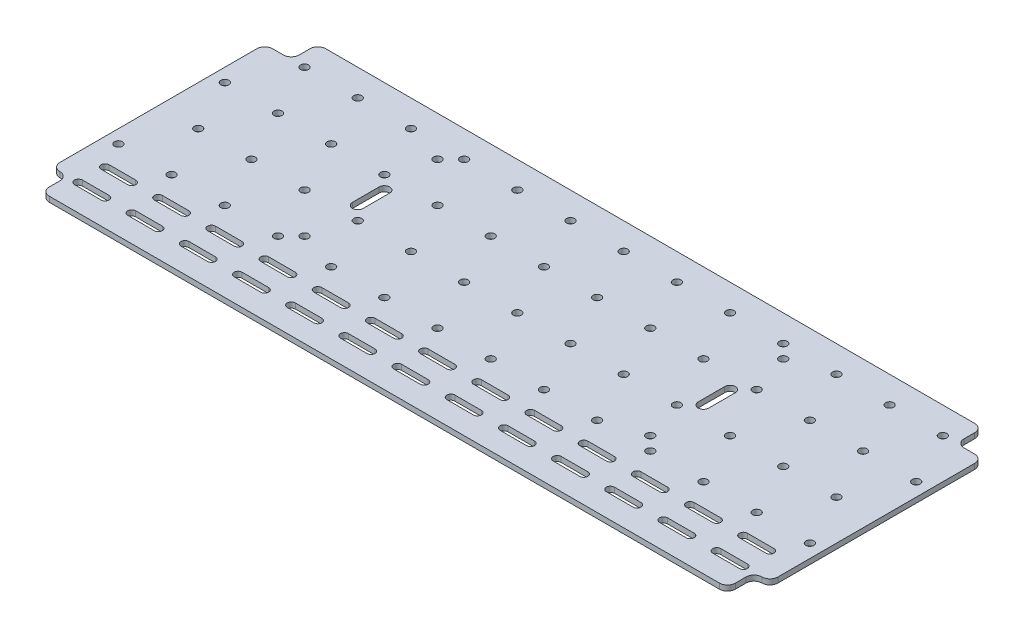
from build123d import *

# Parameters (mm, degrees)
SKETCH_1_W          = 270
SKETCH_1_H          = 100
EXTRUDE_1_DEPTH     = 2
SKETCH_2_W          = 6
SKETCH_2_H          = 10
SKETCH_2_W_2        = 10
CUT_EXTRUDE_1_DEPTH = 10
FILLET_1_R          = 3
SKETCH_3_R          = 1.5
CUT_EXTRUDE_2_DEPTH = 30
SKETCH_4_R          = 1.5
CUT_EXTRUDE_3_DEPTH = 10


with BuildPart() as part:
    # 草图1 → 凸台-拉伸1 (new body)
    with BuildSketch(Plane(origin=(0, 0, 0), x_dir=(1, 0, 0), z_dir=(0, 1, 0))):
        Rectangle(SKETCH_1_W, SKETCH_1_H)
    extrude(amount=EXTRUDE_1_DEPTH)

    # 草图2 → 切除-拉伸1 (cut)
    with BuildSketch(Plane.XZ):
        with Locations((132, 45)):
            Rectangle(SKETCH_2_W, SKETCH_2_H)
        with Locations((130, -45)):
            Rectangle(SKETCH_2_W_2, SKETCH_2_H)
        with Locations((-130, -45)):
            Rectangle(SKETCH_2_W_2, SKETCH_2_H)
        with Locations((-132, 45)):
            Rectangle(SKETCH_2_W, SKETCH_2_H)
    extrude(amount=-CUT_EXTRUDE_1_DEPTH, mode=Mode.SUBTRACT)

    # 圆角1
    fillet_1_edges = [part.edges().sort_by_distance(p)[0] for p in [
        (-125, 1, -40),
        (-125, 1, -50),
        (125, 1, -50),
        (125, 1, -40),
        (135, 1, -40),
        (-135, 1, -40),
        (129, 1, 40),
        (129, 1, 50),
        (-129, 1, 50),
        (-129, 1, 40),
        (135, 1, 40),
        (-135, 1, 40),
    ]]
    fillet(fillet_1_edges, radius=FILLET_1_R - 0.0001)  # a hair under: the kernel refuses the full size

    # 草图3 → 切除-拉伸2 (cut)
    with BuildSketch(Plane.XZ):
        with Locations(Location((-65, 15, 0), (0, 0, 270))):
            Circle(SKETCH_3_R)
        with Locations(Location((-65, -35, 0), (0, 0, 270))):
            Circle(SKETCH_3_R)
        with Locations(Location((65, -35, 0), (0, 0, 270))):
            Circle(SKETCH_3_R)
        with Locations(Location((65, 15, 0), (0, 0, 270))):
            Circle(SKETCH_3_R)
        with BuildLine():
            Line((-63, -5), (-63, -15))
            ThreePointArc((-63, -15), (-65, -17), (-67, -15))
            Line((-67, -15), (-67, -5))
            ThreePointArc((-67, -5), (-65, -3), (-63, -5))
        make_face()
        with BuildLine():
            Line((63, -5), (63, -15))
            ThreePointArc((63, -15), (65, -17), (67, -15))
            Line((67, -15), (67, -5))
            ThreePointArc((67, -5), (65, -3), (63, -5))
        make_face()
    extrude(amount=-CUT_EXTRUDE_2_DEPTH, mode=Mode.SUBTRACT)

    # 草图4 → 切除-拉伸3 (cut)
    with BuildSketch(Plane.XZ):
        with Locations(Location((-130, 20, 0), (0, 0, 270))):
            Circle(SKETCH_4_R)
        with Locations(Location((-110, 20, 0), (0, 0, 270))):
            Circle(SKETCH_4_R)
        with Locations(Location((-120, 0, 0), (0, 0, 270))):
            Circle(SKETCH_4_R)
        with Locations(Location((-130, -20, 0), (0, 0, 270))):
            Circle(SKETCH_4_R)
        with Locations(Location((-110, -20, 0), (0, 0, 270))):
            Circle(SKETCH_4_R)
        with Locations(Location((-120, -40, 0), (0, 0, 270))):
            Circle(SKETCH_4_R)
        with Locations(Location((-100, -40, 0), (0, 0, 270))):
            Circle(SKETCH_4_R)
        with Locations(Location((-90, 20, 0), (0, 0, 270))):
            Circle(SKETCH_4_R)
        with Locations(Location((-70, 20, 0), (0, 0, 270))):
            Circle(SKETCH_4_R)
        with Locations(Location((-80, 0, 0), (0, 0, 270))):
            Circle(SKETCH_4_R)
        with Locations(Location((-90, -20, 0), (0, 0, 270))):
            Circle(SKETCH_4_R)
        with Locations(Location((-70, -20, 0), (0, 0, 270))):
            Circle(SKETCH_4_R)
        with Locations(Location((-80, -40, 0), (0, 0, 270))):
            Circle(SKETCH_4_R)
        with Locations(Location((-60, -40, 0), (0, 0, 270))):
            Circle(SKETCH_4_R)
        with Locations(Location((-50, 20, 0), (0, 0, 270))):
            Circle(SKETCH_4_R)
        with Locations(Location((-30, 20, 0), (0, 0, 270))):
            Circle(SKETCH_4_R)
        with Locations(Location((-40, 0, 0), (0, 0, 270))):
            Circle(SKETCH_4_R)
        with Locations(Location((-50, -20, 0), (0, 0, 270))):
            Circle(SKETCH_4_R)
        with Locations(Location((-30, -20, 0), (0, 0, 270))):
            Circle(SKETCH_4_R)
        with Locations(Location((-40, -40, 0), (0, 0, 270))):
            Circle(SKETCH_4_R)
        with Locations(Location((-20, -40, 0), (0, 0, 270))):
            Circle(SKETCH_4_R)
        with Locations(Location((-10, 20, 0), (0, 0, 270))):
            Circle(SKETCH_4_R)
        with Locations(Location((10, 20, 0), (0, 0, 270))):
            Circle(SKETCH_4_R)
        with Locations(Location((0, 0, 0), (0, 0, 270))):
            Circle(SKETCH_4_R)
        with Locations(Location((-10, -20, 0), (0, 0, 270))):
            Circle(SKETCH_4_R)
        with Locations(Location((10, -20, 0), (0, 0, 270))):
            Circle(SKETCH_4_R)
        with Locations(Location((0, -40, 0), (0, 0, 270))):
            Circle(SKETCH_4_R)
        with Locations(Location((20, -40, 0), (0, 0, 270))):
            Circle(SKETCH_4_R)
        with Locations(Location((30, 20, 0), (0, 0, 270))):
            Circle(SKETCH_4_R)
        with Locations(Location((50, 20, 0), (0, 0, 270))):
            Circle(SKETCH_4_R)
        with Locations(Location((40, 0, 0), (0, 0, 270))):
            Circle(SKETCH_4_R)
        with Locations(Location((30, -20, 0), (0, 0, 270))):
            Circle(SKETCH_4_R)
        with Locations(Location((50, -20, 0), (0, 0, 270))):
            Circle(SKETCH_4_R)
        with Locations(Location((40, -40, 0), (0, 0, 270))):
            Circle(SKETCH_4_R)
        with Locations(Location((60, -40, 0), (0, 0, 270))):
            Circle(SKETCH_4_R)
        with Locations(Location((70, 20, 0), (0, 0, 270))):
            Circle(SKETCH_4_R)
        with Locations(Location((90, 20, 0), (0, 0, 270))):
            Circle(SKETCH_4_R)
        with Locations(Location((80, 0, 0), (0, 0, 270))):
            Circle(SKETCH_4_R)
        with Locations(Location((70, -20, 0), (0, 0, 270))):
            Circle(SKETCH_4_R)
        with Locations(Location((90, -20, 0), (0, 0, 270))):
            Circle(SKETCH_4_R)
        with Locations(Location((80, -40, 0), (0, 0, 270))):
            Circle(SKETCH_4_R)
        with Locations(Location((100, -40, 0), (0, 0, 270))):
            Circle(SKETCH_4_R)
        with Locations(Location((110, 20, 0), (0, 0, 270))):
            Circle(SKETCH_4_R)
        with Locations(Location((130, 20, 0), (0, 0, 270))):
            Circle(SKETCH_4_R)
        with Locations(Location((120, 0, 0), (0, 0, 270))):
            Circle(SKETCH_4_R)
        with Locations(Location((110, -20, 0), (0, 0, 270))):
            Circle(SKETCH_4_R)
        with Locations(Location((130, -20, 0), (0, 0, 270))):
            Circle(SKETCH_4_R)
        with Locations(Location((120, -40, 0), (0, 0, 270))):
            Circle(SKETCH_4_R)
        with Locations((140, -40)):
            Circle(SKETCH_4_R)
        with Locations(Location((-100, 0, 0), (0, 0, 270))):
            Circle(SKETCH_4_R)
        with Locations(Location((-60, 0, 0), (0, 0, 270))):
            Circle(SKETCH_4_R)
        with Locations(Location((-20, 0, 0), (0, 0, 270))):
            Circle(SKETCH_4_R)
        with Locations(Location((20, 0, 0), (0, 0, 270))):
            Circle(SKETCH_4_R)
        with Locations(Location((60, 0, 0), (0, 0, 270))):
            Circle(SKETCH_4_R)
        with Locations(Location((100, 0, 0), (0, 0, 270))):
            Circle(SKETCH_4_R)
        with BuildLine():
            Line((-125, 31.5), (-115, 31.5))
            ThreePointArc((-115, 31.5), (-113.5, 30), (-115, 28.5))
            Line((-115, 28.5), (-125, 28.5))
            ThreePointArc((-125, 28.5), (-126.5, 30), (-125, 31.5))
        make_face()
        with BuildLine():
            Line((-105, 31.5), (-95, 31.5))
            ThreePointArc((-95, 31.5), (-93.5, 30), (-95, 28.5))
            Line((-95, 28.5), (-105, 28.5))
            ThreePointArc((-105, 28.5), (-106.5, 30), (-105, 31.5))
        make_face()
        with BuildLine():
            Line((-85, 31.5), (-75, 31.5))
            ThreePointArc((-75, 31.5), (-73.5, 30), (-75, 28.5))
            Line((-75, 28.5), (-85, 28.5))
            ThreePointArc((-85, 28.5), (-86.5, 30), (-85, 31.5))
        make_face()
        with BuildLine():
            Line((-65, 31.5), (-55, 31.5))
            ThreePointArc((-55, 31.5), (-53.5, 30), (-55, 28.5))
            Line((-55, 28.5), (-65, 28.5))
            ThreePointArc((-65, 28.5), (-66.5, 30), (-65, 31.5))
        make_face()
        with BuildLine():
            Line((-45, 31.5), (-35, 31.5))
            ThreePointArc((-35, 31.5), (-33.5, 30), (-35, 28.5))
            Line((-35, 28.5), (-45, 28.5))
            ThreePointArc((-45, 28.5), (-46.5, 30), (-45, 31.5))
        make_face()
        with BuildLine():
            Line((-25, 31.5), (-15, 31.5))
            ThreePointArc((-15, 31.5), (-13.5, 30), (-15, 28.5))
            Line((-15, 28.5), (-25, 28.5))
            ThreePointArc((-25, 28.5), (-26.5, 30), (-25, 31.5))
        make_face()
        with BuildLine():
            Line((-5, 31.5), (5, 31.5))
            ThreePointArc((5, 31.5), (6.5, 30), (5, 28.5))
            Line((5, 28.5), (-5, 28.5))
            ThreePointArc((-5, 28.5), (-6.5, 30), (-5, 31.5))
        make_face()
        with BuildLine():
            Line((15, 31.5), (25, 31.5))
            ThreePointArc((25, 31.5), (26.5, 30), (25, 28.5))
            Line((25, 28.5), (15, 28.5))
            ThreePointArc((15, 28.5), (13.5, 30), (15, 31.5))
        make_face()
        with BuildLine():
            Line((35, 31.5), (45, 31.5))
            ThreePointArc((45, 31.5), (46.5, 30), (45, 28.5))
            Line((45, 28.5), (35, 28.5))
            ThreePointArc((35, 28.5), (33.5, 30), (35, 31.5))
        make_face()
        with BuildLine():
            Line((55, 31.5), (65, 31.5))
            ThreePointArc((65, 31.5), (66.5, 30), (65, 28.5))
            Line((65, 28.5), (55, 28.5))
            ThreePointArc((55, 28.5), (53.5, 30), (55, 31.5))
        make_face()
        with BuildLine():
            Line((75, 31.5), (85, 31.5))
            ThreePointArc((85, 31.5), (86.5, 30), (85, 28.5))
            Line((85, 28.5), (75, 28.5))
            ThreePointArc((75, 28.5), (73.5, 30), (75, 31.5))
        make_face()
        with BuildLine():
            Line((95, 31.5), (105, 31.5))
            ThreePointArc((105, 31.5), (106.5, 30), (105, 28.5))
            Line((105, 28.5), (95, 28.5))
            ThreePointArc((95, 28.5), (93.5, 30), (95, 31.5))
        make_face()
        with BuildLine():
            Line((115, 31.5), (125, 31.5))
            ThreePointArc((125, 31.5), (126.5, 30), (125, 28.5))
            Line((125, 28.5), (115, 28.5))
            ThreePointArc((115, 28.5), (113.5, 30), (115, 31.5))
        make_face()
        with BuildLine():
            Line((-125, 41.5), (-115, 41.5))
            ThreePointArc((-115, 41.5), (-113.5, 40), (-115, 38.5))
            Line((-115, 38.5), (-125, 38.5))
            ThreePointArc((-125, 38.5), (-126.5, 40), (-125, 41.5))
        make_face()
        with BuildLine():
            Line((-105, 41.5), (-95, 41.5))
            ThreePointArc((-95, 41.5), (-93.5, 40), (-95, 38.5))
            Line((-95, 38.5), (-105, 38.5))
            ThreePointArc((-105, 38.5), (-106.5, 40), (-105, 41.5))
        make_face()
        with BuildLine():
            Line((-85, 41.5), (-75, 41.5))
            ThreePointArc((-75, 41.5), (-73.5, 40), (-75, 38.5))
            Line((-75, 38.5), (-85, 38.5))
            ThreePointArc((-85, 38.5), (-86.5, 40), (-85, 41.5))
        make_face()
        with BuildLine():
            Line((-65, 41.5), (-55, 41.5))
            ThreePointArc((-55, 41.5), (-53.5, 40), (-55, 38.5))
            Line((-55, 38.5), (-65, 38.5))
            ThreePointArc((-65, 38.5), (-66.5, 40), (-65, 41.5))
        make_face()
        with BuildLine():
            Line((-45, 41.5), (-35, 41.5))
            ThreePointArc((-35, 41.5), (-33.5, 40), (-35, 38.5))
            Line((-35, 38.5), (-45, 38.5))
            ThreePointArc((-45, 38.5), (-46.5, 40), (-45, 41.5))
        make_face()
        with BuildLine():
            Line((-25, 41.5), (-15, 41.5))
            ThreePointArc((-15, 41.5), (-13.5, 40), (-15, 38.5))
            Line((-15, 38.5), (-25, 38.5))
            ThreePointArc((-25, 38.5), (-26.5, 40), (-25, 41.5))
        make_face()
        with BuildLine():
            Line((-5, 41.5), (5, 41.5))
            ThreePointArc((5, 41.5), (6.5, 40), (5, 38.5))
            Line((5, 38.5), (-5, 38.5))
            ThreePointArc((-5, 38.5), (-6.5, 40), (-5, 41.5))
        make_face()
        with BuildLine():
            Line((15, 41.5), (25, 41.5))
            ThreePointArc((25, 41.5), (26.5, 40), (25, 38.5))
            Line((25, 38.5), (15, 38.5))
            ThreePointArc((15, 38.5), (13.5, 40), (15, 41.5))
        make_face()
        with BuildLine():
            Line((35, 41.5), (45, 41.5))
            ThreePointArc((45, 41.5), (46.5, 40), (45, 38.5))
            Line((45, 38.5), (35, 38.5))
            ThreePointArc((35, 38.5), (33.5, 40), (35, 41.5))
        make_face()
        with BuildLine():
            Line((55, 41.5), (65, 41.5))
            ThreePointArc((65, 41.5), (66.5, 40), (65, 38.5))
            Line((65, 38.5), (55, 38.5))
            ThreePointArc((55, 38.5), (53.5, 40), (55, 41.5))
        make_face()
        with BuildLine():
            Line((75, 41.5), (85, 41.5))
            ThreePointArc((85, 41.5), (86.5, 40), (85, 38.5))
            Line((85, 38.5), (75, 38.5))
            ThreePointArc((75, 38.5), (73.5, 40), (75, 41.5))
        make_face()
        with BuildLine():
            Line((95, 41.5), (105, 41.5))
            ThreePointArc((105, 41.5), (106.5, 40), (105, 38.5))
            Line((105, 38.5), (95, 38.5))
            ThreePointArc((95, 38.5), (93.5, 40), (95, 41.5))
        make_face()
        with BuildLine():
            Line((115, 41.5), (125, 41.5))
            ThreePointArc((125, 41.5), (126.5, 40), (125, 38.5))
            Line((125, 38.5), (115, 38.5))
            ThreePointArc((115, 38.5), (113.5, 40), (115, 41.5))
        make_face()
    extrude(amount=-CUT_EXTRUDE_3_DEPTH, mode=Mode.SUBTRACT)


solid = part.part
